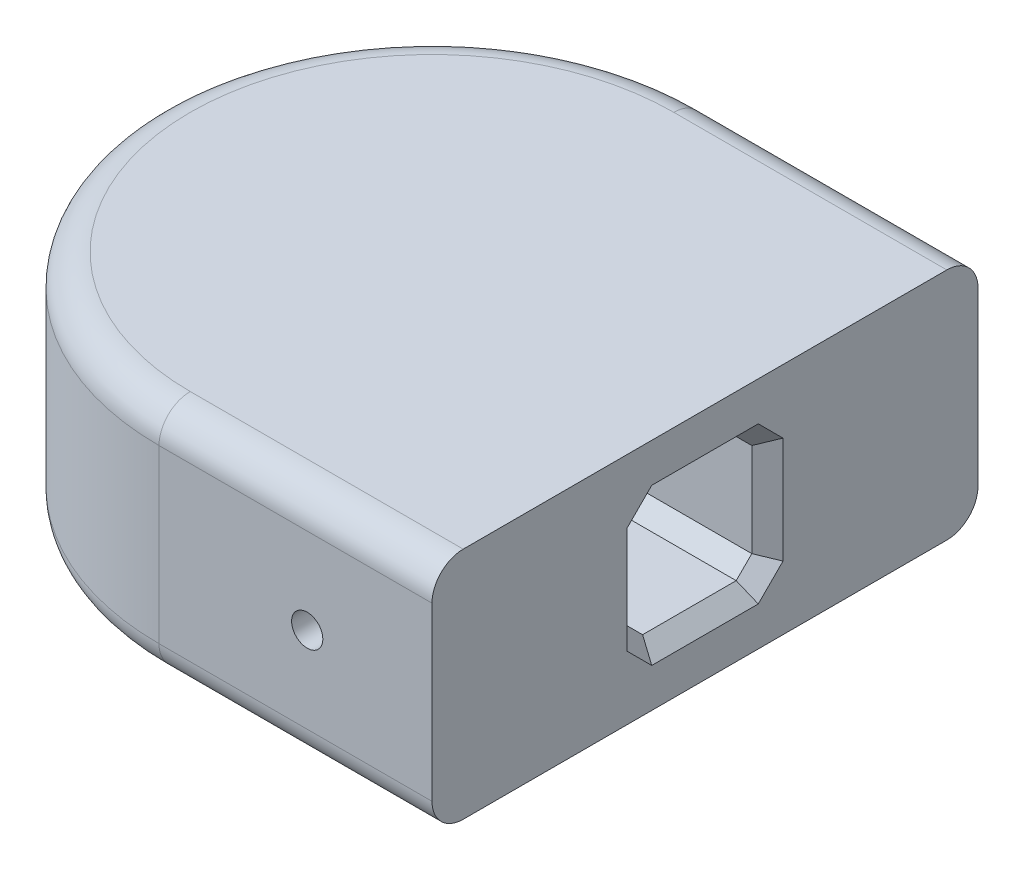
from build123d import *

# Parameters (mm, degrees)
MAIN_BODY_EXTRUDE_DEPTH         = 19.05
SKETCH2_W                       = 10.16
SKETCH2_H                       = 10.16
UPPER_FOOT_CONNECTION_CUT_DEPTH = 15.24
FILLET1_R                       = 2.54
SKETCH3_R                       = 1.27
PINHOLE_CUT_DEPTH               = 64.516
CHAMFER2_SIZE                   = 1.27
CHAMFER1_SIZE                   = 1.27


with BuildPart() as part:
    # Sketch1 → Main body extrude (new body)
    with BuildSketch(Plane(origin=(0, 0, 0), x_dir=(1, 0, 0), z_dir=(0, 1, 0))):
        with BuildLine():
            Line((44.45, 44.45), (22.225, 44.45))
            ThreePointArc((22.225, 44.45), (0, 22.225), (22.225, 0))
            Line((22.225, 0), (44.45, 0))
            Line((44.45, 0), (44.45, 44.45))
        make_face()
    extrude(amount=MAIN_BODY_EXTRUDE_DEPTH)

    # Sketch2 → Upper foot connection cut (cut)
    with BuildSketch(Plane(origin=(44.45, 0, 0), x_dir=(0, 0, -1), z_dir=(1, 0, 0))):
        with Locations((22.225, 9.525)):
            Rectangle(SKETCH2_W, SKETCH2_H)
    extrude(amount=-UPPER_FOOT_CONNECTION_CUT_DEPTH, mode=Mode.SUBTRACT)

    # Fillet1
    fillet1_edges = [part.edges().sort_by_distance(p)[0] for p in [
        (0, 0, -22.225),
        (0, 19.05, -22.225),
        (33.3375, 19.05, -44.45),
        (33.3375, 0, -44.45),
        (33.3375, 0, 0),
        (33.3375, 19.05, 0),
    ]]
    fillet(fillet1_edges, radius=FILLET1_R)

    # Sketch3 → Pinhole cut (cut)
    with BuildSketch(Plane.XY):
        with Locations((34.29, 9.525)):
            Circle(SKETCH3_R)
    extrude(amount=-PINHOLE_CUT_DEPTH, mode=Mode.SUBTRACT)

    # Chamfer2
    chamfer2_edges = [part.edges().sort_by_distance(p)[0] for p in [
        (36.83, 14.605, -17.145),
        (36.83, 4.445, -17.145),
        (36.83, 14.605, -27.305),
        (36.83, 4.445, -27.305),
    ]]
    chamfer(chamfer2_edges, length=CHAMFER2_SIZE)

    # Chamfer1
    chamfer1_edges = [part.edges().sort_by_distance(p)[0] for p in [
        (44.45, 14.605, -22.225),
        (44.45, 9.525, -27.305),
        (44.45, 4.445, -22.225),
        (44.45, 9.525, -17.145),
        (44.45, 13.97, -26.67),
        (44.45, 5.08, -26.67),
        (44.45, 5.08, -17.78),
        (44.45, 13.97, -17.78),
    ]]
    chamfer(chamfer1_edges, length=CHAMFER1_SIZE)


solid = part.part
